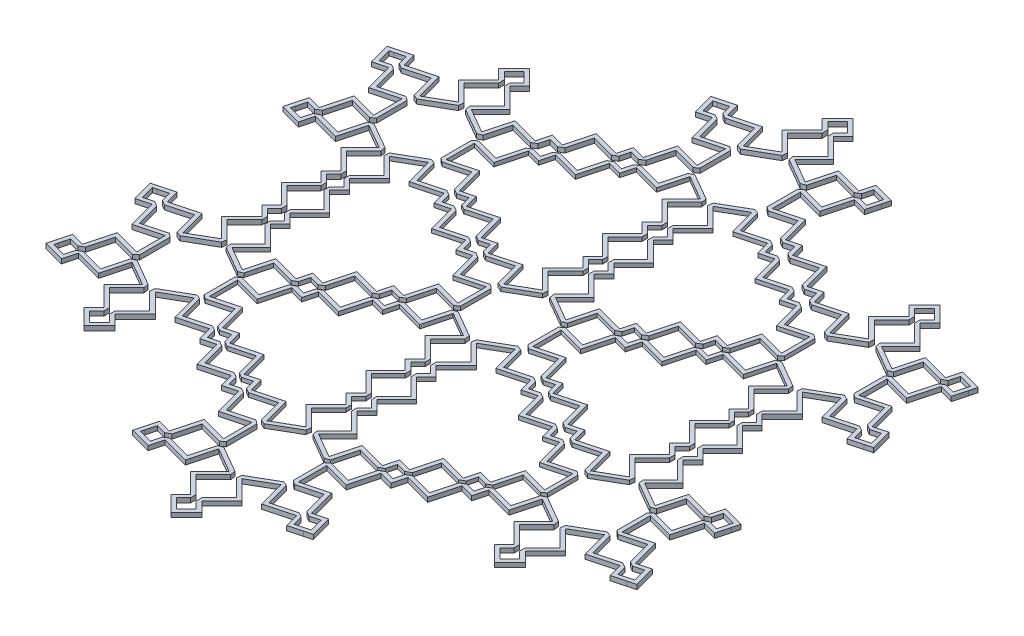
from build123d import *

# Parameters (mm, degrees)
SKETCH1_R                          = 261.8
BOSS_EXTRUDE1_DEPTH                = 10
INNER_FRAMEWORKS_6_TIMES_1_DEPTH   = 8.72
INNER_FRAMEWORKS_6_TIMES_1_2_DEPTH = 8.72
INNER_FRAMEWORKS_6_TIMES_1_3_DEPTH = 8.72
INNER_FRAMEWORKS_6_TIMES_1_4_DEPTH = 8.72
INNER_FRAMEWORKS_6_TIMES_1_5_DEPTH = 8.72
INNER_FRAMEWORKS_6_TIMES_1_6_DEPTH = 8.72
OUTER_FRAMEWORK_DEPTH              = 10
SKETCH26_R                         = 261.8
CUT_BASE_DEPTH                     = 10


with BuildPart() as part:
    # Sketch1 → Boss-Extrude1 (new body)
    with BuildSketch(Plane(origin=(0, 0, 0), x_dir=(1, 0, 0), z_dir=(0, 1, 0))):
        Circle(SKETCH1_R)
    extrude(amount=-BOSS_EXTRUDE1_DEPTH)

    # Sketch26 → Cut base (cut)
    with BuildSketch(Plane(origin=(0, 0, 0), x_dir=(1, 0, 0), z_dir=(0, 1, 0))):
        Circle(SKETCH26_R)
    extrude(amount=-CUT_BASE_DEPTH, mode=Mode.SUBTRACT)


with BuildPart() as body_2:
    # Sketch25 → Inner Frameworks 6 times 1 (new body)
    with BuildSketch(Plane(origin=(7832.178221311, 0, 0), x_dir=(0, 0, 1), z_dir=(0, -1, 0))):
        Polygon((81.060766144, 7824.361621688), (47.292460084, 7765.904634172), (51.497098296, 7755.750396465), (103.552317518, 7741.802242513), (89.524402474, 7689.449350844), (95.690373623, 7678.769575629), (117.067344272, 7673.041633607), (111.339402073, 7651.664662299), (117.505373205, 7640.984887021), (168.689018494, 7627.2702706), (154.974402073, 7576.086625311), (161.140373205, 7565.406850033), (182.517344184, 7559.678907922), (176.789402073, 7538.301936944), (182.955373205, 7527.622161665), (235.296560355, 7513.597382838), (221.356330831, 7461.571737988), (228.047004724, 7452.850180069), (295.556393954, 7452.834462936), (302.247902606, 7461.552905295), (288.30268106, 7513.597179095), (340.644626811, 7527.622161603), (346.810597927, 7538.301936944), (341.082655905, 7559.678907593), (362.459625974, 7565.406849713), (368.62559774, 7576.086625261), (354.91168314, 7627.267646794), (406.097953246, 7640.982966532), (412.263924378, 7651.662741811), (406.535279316, 7673.042336242), (427.909626795, 7678.769575388), (434.075597927, 7689.449350666), (420.051287348, 7741.788790287), (472.08311631, 7755.730676838), (476.289924582, 7765.88549601), (442.529079082, 7824.373357429), (431.632240184, 7825.808460794), (393.53350035, 7787.709720961), (355.230971132, 7826.012250179), (342.899028868, 7826.012250179), (327.25, 7810.363221311), (311.600971132, 7826.012250179), (299.269028868, 7826.012250179), (261.8, 7788.543221311), (224.330971132, 7826.012250179), (211.999028868, 7826.012250179), (196.35, 7810.363221311), (180.700971132, 7826.012250179), (168.369028868, 7826.012250179), (130.055554393, 7787.698775703), (91.959193809, 7825.795136287), align=None)
        Polygon((218.165, 7819.846279047), (261.8, 7776.211279047), (305.435, 7819.846279047), (327.25, 7798.031279047), (349.065, 7819.846279047), (393.53350035, 7775.377778697), (436.145439462, 7817.989717809), (467.570138389, 7763.549036341), (409.37151207, 7747.954761419), (425.652724721, 7687.192448593), (395.855504037, 7679.208307374), (403.841051173, 7649.405839738), (344.231908334, 7633.433618052), (360.202723901, 7573.829722918), (330.402880651, 7565.844878632), (338.387724738, 7536.045034809), (277.622905736, 7519.763150148), (293.219731097, 7461.55500718), (230.383375997, 7461.569636365), (245.976335633, 7519.76335397), (185.212275279, 7536.045034871), (193.197119462, 7565.844879054), (163.397275279, 7573.829723238), (179.368793773, 7633.436241732), (119.762275279, 7649.407760226), (127.747119533, 7679.207604676), (97.947275679, 7687.192448771), (114.232092797, 7747.968213645), (56.013004328, 7763.567971384), (87.443851167, 7817.978536665), (130.055554393, 7775.366833439), (174.535, 7819.846279047), (196.35, 7798.031279047), align=None, mode=Mode.SUBTRACT)
    extrude(amount=-INNER_FRAMEWORKS_6_TIMES_1_DEPTH)


with BuildPart() as body_3:
    # Sketch25 → Inner Frameworks 6 times 1 2 (new body)
    with BuildSketch(Plane(origin=(7832.178221311, 0, 0), x_dir=(0, 0, 1), z_dir=(0, -1, 0))):
        Polygon((-106.825597927, 7634.818915889), (-93.110981506, 7583.6352706), (-144.294626795, 7569.920654179), (-150.460597927, 7559.240878901), (-144.732655816, 7537.863907922), (-166.109626795, 7532.135965812), (-172.275597927, 7521.456190534), (-158.250819099, 7469.115003384), (-210.276463949, 7455.174773861), (-214.484217722, 7445.019701342), (-180.743134543, 7386.546996709), (-169.846987652, 7385.111201405), (-131.747935193, 7423.210254426), (-93.430971177, 7384.893290976), (-81.099028868, 7384.893291021), (-65.450000241, 7400.542319648), (-49.800971819, 7384.893291572), (-37.469029004, 7384.893291158), (-0.001921466, 7422.360400353), (37.469028902, 7384.889449986), (49.800971166, 7384.889449986), (65.451920535, 7400.540399355), (81.099028868, 7384.893291021), (93.430971132, 7384.893291021), (131.746100174, 7423.208420063), (169.836042584, 7385.118477652), (180.733778095, 7386.552684406), (214.505329146, 7445.034364971), (210.299745669, 7455.188855961), (158.255899204, 7469.133962592), (172.275597927, 7521.456190534), (166.109626795, 7532.135965812), (144.732655816, 7537.863907922), (150.460597927, 7559.240878901), (144.294626795, 7569.920654179), (93.110981506, 7583.6352706), (106.825597927, 7634.818915889), (100.659626795, 7645.498691167), (79.282655816, 7651.226633278), (85.010597927, 7672.603604256), (78.844626795, 7683.283379535), (26.507447354, 7697.3070845), (40.45168312, 7749.347680849), (33.761009228, 7758.069238768), (-33.74838002, 7758.084955901), (-40.439888724, 7749.366513542), (-26.491734772, 7697.31129432), (-78.84462644, 7683.283379276), (-85.010597509, 7672.603604015), (-79.282655487, 7651.226633366), (-100.659626795, 7645.498691167), align=None)
        Polygon((98.402724721, 7637.075817962), (82.431206227, 7577.469299468), (142.037724721, 7561.497780974), (134.052880538, 7531.69793679), (163.852724721, 7523.713092607), (147.576123925, 7462.96799146), (205.785115257, 7447.370939241), (174.35045157, 7392.936010931), (131.746100174, 7435.540362327), (87.265, 7391.059262153), (65.451920535, 7412.872341618), (43.635000034, 7391.055421118), (-0.00192112, 7434.692342271), (-43.635000687, 7391.059262704), (-65.450000309, 7412.874261844), (-87.265000045, 7391.059262108), (-131.747935284, 7435.54219669), (-174.359253121, 7392.930878225), (-205.764761425, 7447.356072615), (-147.571043821, 7462.949032252), (-163.852724721, 7523.713092607), (-134.052880538, 7531.69793679), (-142.037724721, 7561.497780974), (-82.431206227, 7577.469299468), (-98.402724721, 7637.075817962), (-68.602880272, 7645.060662217), (-76.587724367, 7674.860506071), (-15.811959493, 7691.145323188), (-31.411717233, 7749.364411657), (31.424637955, 7749.349782472), (15.827672076, 7691.141113368), (76.587724721, 7674.860506329), (68.602880538, 7645.060662146), align=None, mode=Mode.SUBTRACT)
    extrude(amount=-INNER_FRAMEWORKS_6_TIMES_1_2_DEPTH)


with BuildPart() as body_4:
    # Sketch25 → Inner Frameworks 6 times 1 3 (new body)
    with BuildSketch(Plane(origin=(7832.178221311, 0, 0), x_dir=(0, 0, 1), z_dir=(0, -1, 0))):
        Polygon((168.689018494, 8037.086172022), (117.505373205, 8023.371555601), (111.339402073, 8012.691780322), (117.067344184, 7991.314809344), (95.690373205, 7985.586867234), (89.524402073, 7974.907091955), (103.548107039, 7922.569912514), (51.507510689, 7908.625676749), (47.299756916, 7898.47060423), (81.040840104, 7839.997899581), (91.936987021, 7838.562104234), (130.04405229, 7876.669169503), (168.369028915, 7838.344192879), (180.700971132, 7838.344192925), (196.349999759, 7853.993221552), (211.999028868, 7838.344192443), (224.330971132, 7838.344192443), (261.8, 7875.813221311), (299.269028868, 7838.344192443), (311.600971132, 7838.344192443), (327.25, 7853.993221311), (342.899028868, 7838.344192443), (355.230971132, 7838.344192443), (393.547379454, 7876.660600765), (431.632794781, 7838.575185438), (442.531222445, 7840.008700037), (476.299528497, 7898.465687538), (472.094890258, 7908.6199252), (420.050616253, 7922.56514598), (434.075597989, 7974.907091938), (427.909626795, 7985.586867234), (406.532656146, 7991.314809256), (412.260597793, 8012.691779452), (406.094626745, 8023.371555414), (354.913604606, 8037.085467751), (368.628924344, 8088.271737857), (362.462953212, 8098.951513136), (341.083358781, 8104.680158198), (346.810597927, 8126.054505678), (340.644626795, 8136.734280956), (288.305187175, 8150.758591535), (302.247073726, 8202.790420497), (295.556146488, 8211.511032915), (228.023749936, 8211.517213768), (221.332494515, 8202.797826144), (235.277601146, 8150.753979679), (182.955373205, 8136.734280956), (176.789402073, 8126.054505678), (182.517344184, 8104.677534699), (161.140373205, 8098.949592589), (154.974402073, 8088.26981731), align=None)
        Polygon((261.8, 7888.145163575), (218.165, 7844.510163575), (196.349999805, 7866.325163769), (174.535000047, 7844.510164011), (130.04405229, 7889.001111767), (87.424721561, 7846.381781038), (56.019213213, 7900.806975503), (114.227882317, 7916.403941382), (97.947275279, 7977.163994028), (127.747119462, 7985.148838212), (119.762275279, 8014.948682395), (179.368793773, 8030.92020089), (163.397275279, 8090.526719384), (193.197119462, 8098.511563567), (185.212275279, 8128.311407751), (245.957376425, 8144.588008547), (230.360324206, 8202.796999879), (293.219686819, 8202.791246722), (277.625411896, 8144.592620403), (338.387724721, 8128.311407751), (330.403583502, 8098.514187066), (360.206051139, 8090.528639931), (344.233829454, 8030.919497092), (403.837724588, 8014.948681525), (395.852880961, 7985.148838099), (425.652724784, 7977.163994012), (409.370841019, 7916.399174769), (467.578984218, 7900.802350266), (436.148137422, 7846.39178506), (393.547379454, 7888.992543029), (349.065, 7844.510163575), (327.25, 7866.325163575), (305.435, 7844.510163575), align=None, mode=Mode.SUBTRACT)
    extrude(amount=-INNER_FRAMEWORKS_6_TIMES_1_3_DEPTH)


with BuildPart() as body_5:
    # Sketch25 → Inner Frameworks 6 times 1 4 (new body)
    with BuildSketch(Plane(origin=(7832.178221311, 0, 0), x_dir=(0, 0, 1), z_dir=(0, -1, 0))):
        Polygon((-224.330971132, 7826.012250179), (-261.8, 7788.543221311), (-299.269028868, 7826.012250179), (-311.600971132, 7826.012250179), (-327.25, 7810.363221311), (-342.899028868, 7826.012250179), (-355.230971132, 7826.012250179), (-393.547379454, 7787.695841857), (-431.632794781, 7825.781257184), (-442.531222445, 7824.347742584), (-476.299528497, 7765.890755084), (-472.094890258, 7755.736517421), (-420.050616253, 7741.791296642), (-434.075597989, 7689.449350683), (-427.909626795, 7678.769575388), (-406.532656146, 7673.041633366), (-412.260597793, 7651.66466317), (-406.094626745, 7640.984887207), (-354.913604606, 7627.270974871), (-368.628924344, 7576.084704764), (-362.462953212, 7565.404929485), (-341.083358781, 7559.676284423), (-346.810597927, 7538.301936944), (-340.644626795, 7527.622161665), (-288.305187175, 7513.597851087), (-302.247073726, 7461.566022125), (-295.556146488, 7452.845409706), (-228.023749936, 7452.839228853), (-221.332494515, 7461.558616477), (-235.277601146, 7513.602462942), (-182.955373205, 7527.622161665), (-176.789402073, 7538.301936944), (-182.517344184, 7559.678907922), (-161.140373205, 7565.406850033), (-154.974402073, 7576.086625311), (-168.689018494, 7627.2702706), (-117.505373205, 7640.984887021), (-111.339402073, 7651.664662299), (-117.067344184, 7673.041633278), (-95.690373205, 7678.769575388), (-89.524402073, 7689.449350666), (-103.548107039, 7741.786530107), (-51.507510689, 7755.730765873), (-47.299756916, 7765.885838391), (-81.040840104, 7824.35854304), (-91.936987021, 7825.794338388), (-130.04405229, 7787.687273118), (-168.369028915, 7826.012249743), (-180.700971132, 7826.012249696), (-196.349999759, 7810.363221069), (-211.999028868, 7826.012250179), align=None)
        Polygon((-119.762275279, 7649.407760226), (-179.368793773, 7633.436241732), (-163.397275279, 7573.829723238), (-193.197119462, 7565.844879054), (-185.212275279, 7536.045034871), (-245.957376425, 7519.768434074), (-230.360324206, 7461.559442743), (-293.219686819, 7461.5651959), (-277.625411896, 7519.763822219), (-338.387724721, 7536.045034871), (-330.403583502, 7565.842255555), (-360.206051139, 7573.827802691), (-344.233829454, 7633.43694553), (-403.837724588, 7649.407761097), (-395.852880961, 7679.207604523), (-425.652724784, 7687.19244861), (-409.370841019, 7747.957267853), (-467.578984218, 7763.554092355), (-436.148137422, 7817.964657561), (-393.547379454, 7775.363899593), (-349.065, 7819.846279047), (-327.25, 7798.031279047), (-305.435, 7819.846279047), (-261.8, 7776.211279047), (-218.165, 7819.846279047), (-196.349999805, 7798.031278852), (-174.535000047, 7819.846278611), (-130.04405229, 7775.355330854), (-87.424721561, 7817.974661584), (-56.019213213, 7763.549467118), (-114.227882317, 7747.952501239), (-97.947275279, 7687.192448593), (-127.747119462, 7679.20760441), align=None, mode=Mode.SUBTRACT)
    extrude(amount=-INNER_FRAMEWORKS_6_TIMES_1_4_DEPTH)


with BuildPart() as body_6:
    # Sketch25 → Inner Frameworks 6 times 1 5 (new body)
    with BuildSketch(Plane(origin=(7832.178221311, 0, 0), x_dir=(0, 0, 1), z_dir=(0, -1, 0))):
        Polygon((-93.110981506, 8080.721172022), (-106.825597927, 8029.537526733), (-100.659626795, 8018.857751454), (-79.282655816, 8013.129809344), (-85.010597927, 7991.752838366), (-78.844626795, 7981.073063087), (-26.507447354, 7967.049358122), (-40.45168312, 7915.008761772), (-33.761009228, 7906.287203853), (33.74838002, 7906.27148672), (40.439888724, 7914.98992908), (26.491734772, 7967.045148301), (78.84462644, 7981.073063345), (85.010597509, 7991.752838607), (79.282655487, 8013.129809256), (100.659626795, 8018.857751454), (106.825597927, 8029.537526733), (93.110981506, 8080.721172022), (144.294626795, 8094.435788442), (150.460597927, 8105.115563721), (144.732655816, 8126.492534699), (166.109626795, 8132.220476809), (172.275597927, 8142.900252088), (158.250819099, 8195.241439238), (210.276463949, 8209.181668761), (214.484217722, 8219.336741279), (180.743134543, 8277.809445913), (169.846987652, 8279.245241216), (131.747935193, 8241.146188195), (93.430971177, 8279.463151646), (81.099028868, 8279.4631516), (65.450000241, 8263.814122974), (49.800971819, 8279.46315105), (37.469029004, 8279.463151464), (0.001921466, 8241.996042268), (-37.469028902, 8279.466992636), (-49.800971166, 8279.466992636), (-65.451920535, 8263.816043267), (-81.099028868, 8279.4631516), (-93.430971132, 8279.4631516), (-131.746100174, 8241.148022559), (-169.836042584, 8279.23796497), (-180.733778095, 8277.803758216), (-214.505329146, 8219.32207765), (-210.299745669, 8209.167586661), (-158.255899204, 8195.222480029), (-172.275597927, 8142.900252088), (-166.109626795, 8132.220476809), (-144.732655816, 8126.492534699), (-150.460597927, 8105.115563721), (-144.294626795, 8094.435788442), align=None)
        Polygon((82.431206227, 8086.887143153), (98.402724721, 8027.280624659), (68.602880272, 8019.295780405), (76.587724367, 7989.495936551), (15.811959493, 7973.211119433), (31.411717233, 7914.992030964), (-31.424637955, 7915.006660149), (-15.827672076, 7973.215329254), (-76.587724721, 7989.495936292), (-68.602880538, 8019.295780476), (-98.402724721, 8027.280624659), (-82.431206227, 8086.887143153), (-142.037724721, 8102.858661648), (-134.052880538, 8132.658505831), (-163.852724721, 8140.643350015), (-147.576123925, 8201.388451161), (-205.785115257, 8216.985503381), (-174.35045157, 8271.420431691), (-131.746100174, 8228.816080295), (-87.265, 8273.297180468), (-65.451920535, 8251.484101003), (-43.635000034, 8273.301021504), (0.00192112, 8229.66410035), (43.635000687, 8273.297179918), (65.450000309, 8251.482180778), (87.265000045, 8273.297180514), (131.747935284, 8228.814245931), (174.359253121, 8271.425564397), (205.764761425, 8217.000370006), (147.571043821, 8201.40741037), (163.852724721, 8140.643350015), (134.052880538, 8132.658505831), (142.037724721, 8102.858661648), align=None, mode=Mode.SUBTRACT)
    extrude(amount=-INNER_FRAMEWORKS_6_TIMES_1_5_DEPTH)


with BuildPart() as body_7:
    # Sketch25 → Inner Frameworks 6 times 1 6 (new body)
    with BuildSketch(Plane(origin=(7832.178221311, 0, 0), x_dir=(0, 0, 1), z_dir=(0, -1, 0))):
        Polygon((-47.292460084, 7898.45180845), (-51.497098296, 7908.606046156), (-103.552317518, 7922.554200109), (-89.524402474, 7974.907091777), (-95.690373623, 7985.586866992), (-117.067344272, 7991.314809014), (-111.339402073, 8012.691780322), (-117.505373205, 8023.371555601), (-168.689018494, 8037.086172022), (-154.974402073, 8088.26981731), (-161.140373205, 8098.949592589), (-182.517344184, 8104.677534699), (-176.789402073, 8126.054505678), (-182.955373205, 8136.734280956), (-235.296560355, 8150.759059784), (-221.356330831, 8202.784704634), (-228.047004724, 8211.506262553), (-295.556393954, 8211.521979686), (-302.247902606, 8202.803537326), (-288.30268106, 8150.759263526), (-340.644626811, 8136.734281018), (-346.810597927, 8126.054505678), (-341.082655905, 8104.677535029), (-362.459625974, 8098.949592909), (-368.62559774, 8088.26981736), (-354.91168314, 8037.088795828), (-406.097953246, 8023.373476089), (-412.263924378, 8012.693700811), (-406.535279316, 7991.314106379), (-427.909626795, 7985.586867234), (-434.075597927, 7974.907091955), (-420.051287348, 7922.567652335), (-472.08311631, 7908.625765784), (-476.289924582, 7898.470946611), (-442.529079082, 7839.983085193), (-431.632240184, 7838.547981827), (-393.53350035, 7876.646721661), (-355.230971132, 7838.344192443), (-342.899028868, 7838.344192443), (-327.25, 7853.993221311), (-311.600971132, 7838.344192443), (-299.269028868, 7838.344192443), (-261.8, 7875.813221311), (-224.330971132, 7838.344192443), (-211.999028868, 7838.344192443), (-196.35, 7853.993221311), (-180.700971132, 7838.344192443), (-168.369028868, 7838.344192443), (-130.055554393, 7876.657666918), (-91.959193809, 7838.561306334), (-81.060766144, 7839.994820933), align=None)
        Polygon((-218.165, 7844.510163575), (-261.8, 7888.145163575), (-305.435, 7844.510163575), (-327.25, 7866.325163575), (-349.065, 7844.510163575), (-393.53350035, 7888.978663925), (-436.145439462, 7846.366724813), (-467.570138389, 7900.80740628), (-409.37151207, 7916.401681203), (-425.652724721, 7977.163994028), (-395.855504037, 7985.148135247), (-403.841051173, 8014.950602884), (-344.231908334, 8030.922824569), (-360.202723901, 8090.526719703), (-330.402880651, 8098.51156399), (-338.387724738, 8128.311407813), (-277.622905736, 8144.593292473), (-293.219731097, 8202.801435442), (-230.383375997, 8202.786806257), (-245.976335633, 8144.593088652), (-185.212275279, 8128.311407751), (-193.197119462, 8098.511563567), (-163.397275279, 8090.526719384), (-179.368793773, 8030.92020089), (-119.762275279, 8014.948682395), (-127.747119533, 7985.148837946), (-97.947275679, 7977.163993851), (-114.232092797, 7916.388228977), (-56.013004328, 7900.788471237), (-87.443851167, 7846.377905957), (-130.055554393, 7888.989609182), (-174.535, 7844.510163575), (-196.35, 7866.325163575), align=None, mode=Mode.SUBTRACT)
    extrude(amount=-INNER_FRAMEWORKS_6_TIMES_1_6_DEPTH)


with BuildPart() as body_8:
    # Sketch24 → Outer Framework (new body)
    with BuildSketch(Plane(origin=(-2617.991778689, 0, 0), x_dir=(0, 0, 1), z_dir=(0, -1, 0))):
        Polygon((-380.83710473, -3272.791375327), (-363.99065537, -3268.280194624), (-334.190811187, -3260.29535044), (-342.17635832, -3230.492882813), (-281.424743145, -3214.214536588), (-297.022314629, -3156.003607333), (-234.176913776, -3155.988976091), (-249.776671861, -3214.208065849), (-189.000908459, -3230.492882572), (-196.985752731, -3260.292727085), (-150.340162467, -3272.791375327), (-145.823734876, -3255.946331866), (-137.838890693, -3226.146487683), (-167.64135832, -3218.160940549), (-151.363012095, -3157.409325374), (-209.57394135, -3141.81175389), (-178.163911951, -3087.378724619), (-135.544580278, -3129.998056293), (-91.053633598, -3085.507109613), (-69.238633357, -3107.322109854), (-47.423633598, -3085.507110096), (-12.44454082, -3120.486202874), (-3.788633598, -3129.142110096), (39.844445908, -3085.50903059), (61.659445908, -3107.32403059), (83.476366402, -3085.507110096), (127.949635352, -3129.980379046), (170.562993123, -3087.367021275), (201.998364576, -3141.785419303), (143.779274818, -3157.385177388), (160.064091541, -3218.160940791), (130.264247028, -3226.145785063), (142.76289527, -3272.791375327), (159.60934463, -3268.280194624), (189.409188813, -3260.29535044), (181.42364168, -3230.492882813), (242.175256855, -3214.214536588), (226.577685371, -3156.003607333), (289.423086224, -3155.988976091), (273.823328139, -3214.208065849), (334.599091541, -3230.492882572), (326.614247269, -3260.292727085), (373.259837533, -3272.791375327), (377.776265124, -3255.946331866), (385.761109307, -3226.146487683), (355.95864168, -3218.160940549), (372.236987905, -3157.409325374), (314.02605865, -3141.81175389), (345.436088049, -3087.378724619), (388.055419722, -3129.998056293), (432.546366402, -3085.507109613), (454.361366643, -3107.322109854), (488.508308665, -3073.175167832), (476.178286896, -3060.841305074), (454.363286896, -3039.026305074), (432.546366402, -3060.843225568), (388.073097452, -3016.369956618), (345.459739681, -3058.983314389), (314.024368227, -3004.56491636), (372.243457985, -2988.965158275), (355.958641262, -2928.189394873), (385.758485776, -2920.204550601), (377.77364168, -2890.404706747), (425.555971017, -2877.601470189), (437.380160174, -2874.433188253), (421.40934463, -2814.829293202), (451.209188813, -2806.844449019), (443.22364168, -2777.041981392), (503.975256855, -2760.763635167), (488.377685371, -2702.552705911), (551.223086224, -2702.538074669), (535.623328139, -2760.757164427), (596.399091541, -2777.04198115), (588.414247269, -2806.841825664), (635.059837533, -2819.340473905), (639.576265124, -2802.495430445), (647.561109307, -2772.695586261), (617.75864168, -2764.710039128), (634.036987905, -2703.958423953), (575.82605865, -2688.360852468), (607.236088049, -2633.927823197), (649.855419722, -2676.547154871), (694.346366402, -2632.056208192), (716.161366643, -2653.871208433), (750.308308665, -2619.724266411), (737.978286896, -2607.390403652), (716.163286896, -2585.575403652), (694.346366402, -2607.392324146), (649.873097452, -2562.919055196), (607.259739681, -2605.532412967), (575.824368227, -2551.114014939), (634.043457985, -2535.514256854), (617.758641262, -2474.738493451), (647.558485776, -2466.75364918), (635.059837534, -2420.108058916), (618.213388174, -2424.619239618), (588.41354399, -2432.604083802), (596.399091123, -2462.406551429), (535.647475948, -2478.684897654), (551.245047433, -2536.895826909), (488.39964658, -2536.910458152), (503.999404665, -2478.691368393), (443.223641262, -2462.40655167), (451.208485534, -2432.606707157), (421.40864168, -2424.621863062), (434.211878238, -2376.839533725), (437.380160174, -2365.015344568), (377.776265124, -2349.044529023), (385.761109307, -2319.244684839), (355.95864168, -2311.259137706), (372.236987905, -2250.507522531), (314.02605865, -2234.909951047), (345.436088049, -2180.476921776), (388.055419722, -2223.096253449), (432.546366402, -2178.60530677), (454.361366643, -2200.420307011), (488.508308665, -2166.273364989), (476.178286896, -2153.939502231), (454.363286896, -2132.124502231), (432.546366402, -2153.941422725), (388.073097452, -2109.468153775), (345.459739681, -2152.081511546), (314.024368227, -2097.663113517), (372.243457985, -2082.063355432), (355.958641262, -2021.28759203), (385.758485776, -2013.302747758), (373.259837534, -1966.657157494), (356.413388174, -1971.168338197), (326.61354399, -1979.15318238), (334.599091123, -2008.955650007), (273.847475948, -2025.233996232), (289.445047433, -2083.444925488), (226.59964658, -2083.45955673), (242.199404665, -2025.240466972), (181.423641262, -2008.955650249), (189.408485534, -1979.155805735), (142.76289527, -1966.657157494), (138.24646768, -1983.502200955), (130.261623496, -2013.302045138), (160.064091123, -2021.287592271), (143.785744898, -2082.039207446), (201.996674154, -2097.636778931), (170.586644755, -2152.069808202), (127.967313081, -2109.450476528), (83.476366402, -2153.941423207), (61.66136616, -2132.126422966), (39.846366402, -2153.941422725), (4.867273624, -2118.962329947), (-3.788633598, -2110.306422725), (-47.421713104, -2153.939502231), (-69.236713104, -2132.124502231), (-91.053633598, -2153.941422725), (-135.526902548, -2109.468153775), (-178.140260319, -2152.081511546), (-209.575631773, -2097.663113517), (-151.356542015, -2082.063355432), (-167.641358738, -2021.28759203), (-137.841514224, -2013.302747758), (-150.340162466, -1966.657157494), (-167.186611826, -1971.168338197), (-196.98645601, -1979.15318238), (-189.000908877, -2008.955650007), (-249.752524052, -2025.233996232), (-234.154952567, -2083.444925488), (-297.00035342, -2083.45955673), (-281.400595335, -2025.240466972), (-342.176358738, -2008.955650249), (-334.191514466, -1979.155805735), (-380.83710473, -1966.657157494), (-385.35353232, -1983.502200955), (-393.338376504, -2013.302045138), (-363.535908877, -2021.287592271), (-379.814255102, -2082.039207446), (-321.603325846, -2097.636778931), (-353.013355245, -2152.069808202), (-395.632686919, -2109.450476528), (-440.123633598, -2153.941423207), (-461.93863384, -2132.126422966), (-496.085575862, -2166.273364988), (-483.755554092, -2178.607227747), (-461.940554092, -2200.422227747), (-440.123633598, -2178.605307253), (-395.650364648, -2223.078576203), (-353.037006877, -2180.465218432), (-321.601635424, -2234.88361646), (-379.820725182, -2250.483374545), (-363.535908459, -2311.259137948), (-393.335752972, -2319.243982219), (-385.350908877, -2349.043826073), (-433.133238213, -2361.847062632), (-444.957427371, -2365.015344568), (-428.986611826, -2424.619239618), (-458.78645601, -2432.604083802), (-450.800908877, -2462.406551429), (-511.552524052, -2478.684897654), (-495.954952567, -2536.895826909), (-558.80035342, -2536.910458152), (-543.200595335, -2478.691368393), (-603.976358738, -2462.40655167), (-595.991514466, -2432.606707157), (-642.63710473, -2420.108058915), (-647.15353232, -2436.953102376), (-655.138376504, -2466.75294656), (-625.335908877, -2474.738493693), (-641.614255102, -2535.490108868), (-583.403325846, -2551.087680352), (-614.813355245, -2605.520709623), (-657.432686919, -2562.90137795), (-701.923633598, -2607.392324629), (-723.73863384, -2585.577324388), (-757.885575862, -2619.72426641), (-745.555554092, -2632.058129168), (-723.740554092, -2653.873129168), (-701.923633598, -2632.056208674), (-657.450364648, -2676.529477624), (-614.837006877, -2633.916119853), (-583.401635424, -2688.334517882), (-641.620725182, -2703.934275967), (-625.335908459, -2764.710039369), (-655.135752972, -2772.694883641), (-642.63710473, -2819.340473905), (-625.79065537, -2814.829293202), (-595.990811187, -2806.844449019), (-603.97635832, -2777.041981392), (-543.224743145, -2760.763635167), (-558.822314629, -2702.552705911), (-495.976913776, -2702.538074669), (-511.576671861, -2760.757164427), (-450.800908459, -2777.04198115), (-458.785752731, -2806.841825664), (-428.985908877, -2814.826669759), (-441.789145435, -2862.608999095), (-444.957427371, -2874.433188253), (-385.35353232, -2890.404003798), (-393.338376504, -2920.203847981), (-363.535908877, -2928.189395114), (-379.814255102, -2988.941010289), (-321.603325846, -3004.538581774), (-353.013355245, -3058.971611045), (-395.632686919, -3016.352279371), (-440.123633598, -3060.84322605), (-461.93863384, -3039.028225809), (-496.085575862, -3073.175167832), (-489.919605029, -3079.343059458), (-483.755554092, -3085.50903059), (-461.940554092, -3107.32403059), (-440.123633598, -3085.507110096), (-395.650364648, -3129.980379046), (-353.037006877, -3087.367021275), (-321.601635424, -3141.785419303), (-379.820725182, -3157.385177388), (-363.535908459, -3218.160940791), (-393.335752972, -3226.145785063), align=None)
        Polygon((-383.096630247, -2881.981130592), (-434.277652092, -2868.267217121), (-420.563035495, -2817.083571173), (-426.729006144, -2806.40379673), (-448.105977452, -2800.675854532), (-442.378035254, -2779.298883224), (-448.544006386, -2768.619107945), (-500.896896583, -2754.591193295), (-486.948742287, -2702.535972791), (-493.640250989, -2693.817530427), (-561.158685903, -2693.833249613), (-567.849359796, -2702.554807527), (-553.904518423, -2754.597664035), (-606.233260393, -2768.619108187), (-612.399231525, -2779.298883465), (-606.670586465, -2800.678477887), (-628.047557443, -2806.406419997), (-636.471133598, -2808.660698627), (-644.455977693, -2778.860854773), (-623.079006386, -2773.132912574), (-616.913035254, -2762.453137296), (-630.940949903, -2710.100247099), (-578.885729399, -2696.152092803), (-574.681091181, -2685.997855095), (-608.453921853, -2627.533034829), (-619.352349513, -2626.099520226), (-657.450364648, -2664.19753536), (-695.757662466, -2625.890237542), (-708.08960473, -2625.890237542), (-723.740554092, -2641.541186904), (-739.38958296, -2625.892158036), (-745.553633598, -2619.72426641), (-723.73863384, -2597.909266652), (-708.08960473, -2613.558295761), (-695.757662466, -2613.558295761), (-657.432686919, -2575.233320214), (-619.32562071, -2613.340386422), (-608.42947379, -2611.904591078), (-574.683869548, -2553.424051626), (-578.891623315, -2543.268979109), (-630.934479823, -2529.324137736), (-616.913035672, -2476.995395766), (-623.079006803, -2466.315620487), (-644.458601225, -2460.586975428), (-638.730659115, -2439.210004449), (-636.471133598, -2430.787834194), (-606.671289744, -2438.772678289), (-612.399231943, -2460.149649597), (-606.233260811, -2470.829424875), (-553.880370614, -2484.857339525), (-567.82852491, -2536.912560029), (-561.137016207, -2545.631002394), (-493.618581294, -2545.615283208), (-486.9279074, -2536.893725294), (-500.872748773, -2484.850868786), (-448.544006803, -2470.829424634), (-442.378035672, -2460.149649356), (-448.106680731, -2438.770054934), (-426.729709753, -2433.042112823), (-420.563738621, -2422.362337545), (-434.277652092, -2371.1813157), (-383.094006144, -2357.466699102), (-376.928035495, -2346.786924659), (-382.655977693, -2325.409953351), (-361.279006386, -2319.682011153), (-355.113035254, -2309.002235874), (-369.140949903, -2256.649345677), (-317.085729399, -2242.701191381), (-312.881091181, -2232.546953673), (-346.653921853, -2174.082133407), (-357.552349513, -2172.648618804), (-395.650364648, -2210.746633939), (-433.957662466, -2172.439336121), (-446.28960473, -2172.439336121), (-461.940554092, -2188.090285483), (-477.58958296, -2172.441256615), (-483.753633598, -2166.273364989), (-461.93863384, -2144.45836523), (-446.28960473, -2160.107394339), (-433.957662466, -2160.107394339), (-395.632686919, -2121.782418792), (-357.525620711, -2159.889485), (-346.62947379, -2158.453689657), (-312.883869548, -2099.973150204), (-317.091623315, -2089.818077687), (-369.134479823, -2075.873236314), (-355.113035672, -2023.544494344), (-361.279006803, -2012.864719066), (-382.658601225, -2007.136074006), (-376.930659115, -1985.759103028), (-374.671133598, -1977.336932772), (-344.871289744, -1985.321776867), (-350.599231943, -2006.698748175), (-344.433260811, -2017.378523454), (-292.080370614, -2031.406438104), (-306.02852491, -2083.461658608), (-299.337016207, -2092.180100972), (-231.818581294, -2092.164381786), (-225.1279074, -2083.442823872), (-239.072748773, -2031.399967364), (-186.744006803, -2017.378523213), (-180.578035672, -2006.698747934), (-186.306680731, -1985.319153512), (-164.929709753, -1979.591211402), (-156.506133598, -1977.336932772), (-148.521289503, -2007.136776626), (-169.898260811, -2012.864718825), (-176.064231943, -2023.544494103), (-162.036317293, -2075.8973843), (-214.091537797, -2089.845538596), (-218.296176015, -2099.999776304), (-184.523345344, -2158.46459657), (-173.624917683, -2159.898111174), (-135.526902548, -2121.800096039), (-97.21960473, -2160.107393857), (-84.887662466, -2160.107393857), (-69.236713104, -2144.456444495), (-53.587684236, -2160.105473363), (-41.255741972, -2160.105473363), (-3.788633598, -2122.638364989), (33.680395752, -2160.107394339), (46.012337051, -2160.107394339), (61.66136616, -2144.45836523), (77.31039527, -2160.107394339), (89.642337534, -2160.107394339), (127.967313081, -2121.782418792), (166.074379289, -2159.889485), (176.97052621, -2158.453689657), (210.716130452, -2099.973150204), (206.508376685, -2089.818077687), (154.465520177, -2075.873236314), (168.486964328, -2023.544494345), (162.320993197, -2012.864719066), (140.941398775, -2007.136074006), (146.669340885, -1985.759103028), (148.928866402, -1977.336932772), (178.728710256, -1985.321776867), (173.000768057, -2006.698748175), (179.166739189, -2017.378523454), (231.519629386, -2031.406438104), (217.57147509, -2083.461658608), (224.262983793, -2092.180100972), (291.781418706, -2092.164381786), (298.4720926, -2083.442823872), (284.527251227, -2031.399967364), (336.855993197, -2017.378523213), (343.021964328, -2006.698747934), (337.293319269, -1985.319153512), (358.670290247, -1979.591211402), (367.093866402, -1977.336932772), (375.078710497, -2007.136776626), (353.701739189, -2012.864718825), (347.535768057, -2023.544494103), (361.563682707, -2075.8973843), (309.508462203, -2089.845538596), (305.303823985, -2099.999776304), (339.076654656, -2158.46459657), (349.975082317, -2159.898111174), (388.073097452, -2121.800096039), (426.38039527, -2160.107393857), (438.712337534, -2160.107393857), (454.363286896, -2144.456444495), (470.012315764, -2160.105473363), (476.176366402, -2166.273364989), (454.361366643, -2188.088364748), (438.712337534, -2172.439335638), (426.38039527, -2172.439335638), (388.055419722, -2210.764311186), (349.948353514, -2172.657244977), (339.052206594, -2174.093040321), (305.306602352, -2232.573579773), (309.514356119, -2242.72865229), (361.557212627, -2256.673493663), (347.535768475, -2309.002235633), (353.701739607, -2319.682010912), (375.081334029, -2325.410655971), (369.353391919, -2346.78762695), (375.519363051, -2357.467402228), (426.700384896, -2371.1813157), (412.985768298, -2422.364961648), (419.151738948, -2433.04473609), (440.528710256, -2438.772678289), (434.800768057, -2460.149649597), (440.966739189, -2470.829424875), (493.319629386, -2484.857339525), (479.37147509, -2536.91256003), (486.062983793, -2545.631002394), (553.581418706, -2545.615283208), (560.2720926, -2536.893725294), (546.327251227, -2484.850868786), (598.655993197, -2470.829424634), (604.821964328, -2460.149649356), (599.093319269, -2438.770054934), (620.470290247, -2433.042112823), (628.893866402, -2430.787834194), (636.878710497, -2460.587678048), (615.501739189, -2466.315620246), (609.335768057, -2476.995395525), (623.363682707, -2529.348285722), (571.308462203, -2543.296440018), (567.103823985, -2553.450677726), (600.876654656, -2611.915497992), (611.775082317, -2613.349012595), (649.873097452, -2575.25099746), (688.18039527, -2613.558295278), (700.512337534, -2613.558295278), (716.163286896, -2597.907345916), (731.812315764, -2613.556374784), (737.976366402, -2619.72426641), (716.161366643, -2641.539266169), (700.512337534, -2625.89023706), (688.18039527, -2625.89023706), (649.855419722, -2664.215212607), (611.748353514, -2626.108146399), (600.852206594, -2627.543941742), (567.106602352, -2686.024481195), (571.314356119, -2696.179553712), (623.357212627, -2710.124395085), (609.335768475, -2762.453137055), (615.501739607, -2773.132912333), (636.881334029, -2778.861557393), (631.153391919, -2800.238528371), (628.893866402, -2808.660698627), (599.094022548, -2800.675854532), (604.821964746, -2779.298883224), (598.655993614, -2768.619107945), (546.303103417, -2754.591193295), (560.251257713, -2702.535972791), (553.559749011, -2693.817530427), (486.041314097, -2693.833249613), (479.350640204, -2702.554807527), (493.295481577, -2754.597664035), (440.966739607, -2768.619108187), (434.800768475, -2779.298883465), (440.529413535, -2800.678477887), (419.152442557, -2806.406419997), (412.986471425, -2817.086195276), (426.700384896, -2868.267217121), (375.516738948, -2881.981833719), (369.350768298, -2892.661608161), (375.078710497, -2914.038579469), (353.701739189, -2919.766521668), (347.535768057, -2930.446296946), (361.563682707, -2982.799187143), (309.508462203, -2996.747341439), (305.303823985, -3006.901579148), (339.076654656, -3065.366399413), (349.975082317, -3066.799914017), (388.073097452, -3028.701898882), (426.38039527, -3067.0091967), (438.712337534, -3067.0091967), (454.363286896, -3051.358247338), (470.012315764, -3067.007276206), (476.176366402, -3073.175167832), (454.361366643, -3094.990167591), (438.712337534, -3079.341138481), (426.38039527, -3079.341138481), (388.055419722, -3117.666114029), (349.948353514, -3079.55904782), (339.052206594, -3080.994843164), (305.306602352, -3139.475382616), (309.514356119, -3149.630455133), (361.557212627, -3163.575296506), (347.535768475, -3215.904038476), (353.701739607, -3226.583813755), (375.081334029, -3232.312458814), (369.353391919, -3253.689429793), (367.093866402, -3262.111600048), (337.294022548, -3254.126755953), (343.021964746, -3232.749784645), (336.855993614, -3222.070009367), (284.503103417, -3208.042094717), (298.451257713, -3155.986874213), (291.759749011, -3147.268431848), (224.241314097, -3147.284151035), (217.550640204, -3156.005708948), (231.495481577, -3208.048565456), (179.166739607, -3222.070009608), (173.000768475, -3232.749784887), (178.729413535, -3254.129379308), (157.352442557, -3259.857321419), (148.928866402, -3262.111600048), (140.944022307, -3232.311756194), (162.320993614, -3226.583813996), (168.486964746, -3215.904038717), (154.459050097, -3163.55114852), (206.514270601, -3149.602994224), (210.718908819, -3139.448756516), (176.946078147, -3080.98393625), (166.047650487, -3079.550421647), (127.949635352, -3117.648436782), (89.642337534, -3079.341138964), (77.31039527, -3079.341138964), (61.659445908, -3094.992088326), (46.01041704, -3079.343059458), (33.678474776, -3079.343059458), (-3.788633598, -3116.810167832), (-41.257662949, -3079.341138481), (-53.589604248, -3079.341138481), (-69.238633357, -3094.990167591), (-84.887662466, -3079.341138481), (-97.21960473, -3079.341138481), (-135.544580278, -3117.666114029), (-173.651646486, -3079.55904782), (-184.547793406, -3080.994843164), (-218.293397648, -3139.475382616), (-214.085643881, -3149.630455133), (-162.042787373, -3163.575296506), (-176.064231525, -3215.904038476), (-169.898260393, -3226.583813755), (-148.518665971, -3232.312458814), (-154.246608081, -3253.689429793), (-156.506133598, -3262.111600048), (-186.305977452, -3254.126755953), (-180.578035254, -3232.749784645), (-186.744006386, -3222.070009367), (-239.096896583, -3208.042094717), (-225.148742287, -3155.986874213), (-231.840250989, -3147.268431848), (-299.358685903, -3147.284151035), (-306.049359796, -3156.005708948), (-292.104518423, -3208.048565456), (-344.433260393, -3222.070009608), (-350.599231525, -3232.749784887), (-344.870586465, -3254.129379308), (-366.247557443, -3259.857321419), (-374.671133598, -3262.111600048), (-382.655977693, -3232.311756194), (-361.279006386, -3226.583813996), (-355.113035254, -3215.904038717), (-369.140949903, -3163.55114852), (-317.085729399, -3149.602994224), (-312.881091181, -3139.448756516), (-346.653921853, -3080.98393625), (-357.552349513, -3079.550421647), (-395.650364648, -3117.648436782), (-433.957662466, -3079.341138964), (-446.28960473, -3079.341138964), (-461.940554092, -3094.992088326), (-477.58958296, -3079.343059458), (-483.753633598, -3073.175167832), (-461.93863384, -3051.360168073), (-446.28960473, -3067.009197182), (-433.957662466, -3067.009197182), (-395.632686919, -3028.684221635), (-357.52562071, -3066.791287843), (-346.62947379, -3065.3554925), (-312.883869548, -3006.874953048), (-317.091623315, -2996.71988053), (-369.134479823, -2982.775039157), (-355.113035672, -2930.446297188), (-361.279006803, -2919.766521909), (-382.658601225, -2914.037876849), (-376.930659115, -2892.660905871), align=None, mode=Mode.SUBTRACT)
    extrude(amount=-OUTER_FRAMEWORK_DEPTH)


solid = Compound([body_2.part, body_3.part, body_4.part, body_5.part, body_6.part, body_7.part, body_8.part])
